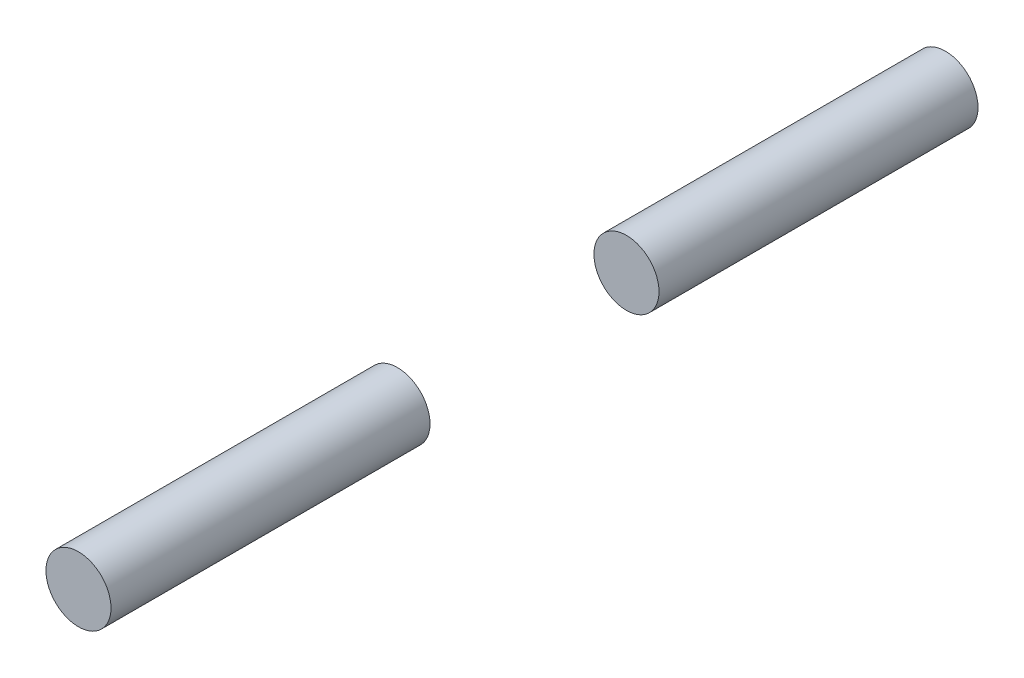
from build123d import *

# Parameters (mm, degrees)
BOSS_EXTRUDE1_START     = -62.28334
BOSS_EXTRUDE1_OUTLINE_R = 6.35
BOSS_EXTRUDE1_DEPTH     = 62.28334
SKETCH3_R               = 6.35
BOSS_EXTRUDE2_DEPTH     = 62.28334


# Read off the part's stored shape, not the designer's step: Boss-Extrude1
with BuildPart() as part:
    # Boss-Extrude1 outline → Boss-Extrude1 (new body)
    with BuildSketch(Plane.XY.offset(146.41068).offset(BOSS_EXTRUDE1_START)):
        with Locations((-36.068, 0)):
            Circle(BOSS_EXTRUDE1_OUTLINE_R)
    extrude(amount=BOSS_EXTRUDE1_DEPTH)


with BuildPart() as body_2:
    # Sketch3 → Boss-Extrude2 (new body)
    with BuildSketch(Plane.XY.offset(39.42334)):
        with Locations((-36.068, 0)):
            Circle(SKETCH3_R)
    extrude(amount=-BOSS_EXTRUDE2_DEPTH)


solid = Compound([part.part, body_2.part])
